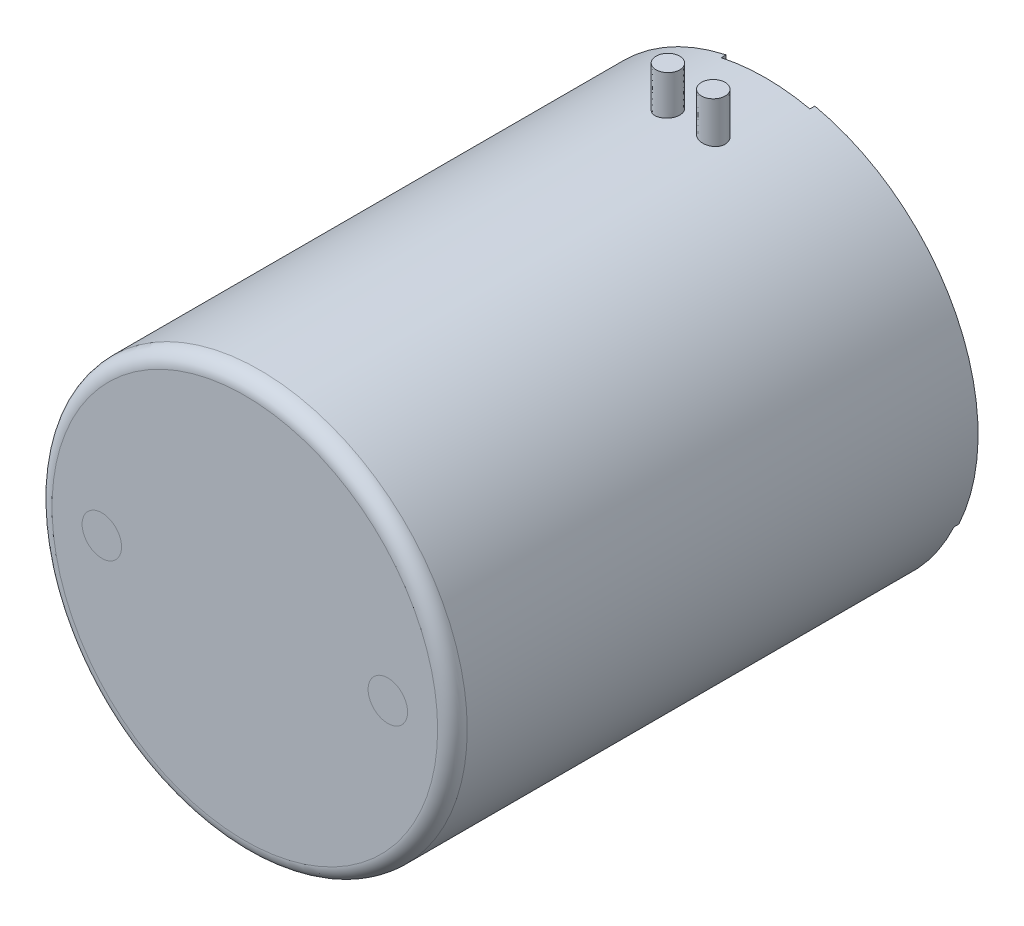
from build123d import *

# Parameters (mm, degrees)
SKETCH_1_R          = 21.05
EXTRUDE_1_DEPTH     = 53.3
FILLET_1_R          = 1.5
CUT_EXTRUDE_1_DEPTH = 0.5
SKETCH_3_R          = 7.5
EXTRUDE_2_DEPTH     = 4.2
SKETCH_4_R          = 6.5
CUT_EXTRUDE_2_DEPTH = 1
SKETCH_5_R          = 2.5
EXTRUDE_3_DEPTH     = 1.3
FILLET_2_R          = 0.75
FILLET_3_R          = 2.5
FILLET_4_R          = 0.5
SKETCH_7_W          = 9
SKETCH_7_H          = 4.55
CUT_EXTRUDE_3_DEPTH = 0.5
SKETCH_9_R          = 21
EXTRUDE_4_DEPTH     = 39.2
EXTRUDE_5_DEPTH     = 2
SKETCH_11_R         = 8
EXTRUDE_6_DEPTH     = 0.5
SKETCH_12_R         = 7.1
EXTRUDE_7_DEPTH     = 1
SKETCH_13_R         = 4
EXTRUDE_8_DEPTH     = 20
SKETCH_14_W         = 8
SKETCH_14_H         = 12
CUT_EXTRUDE_4_DEPTH = 1
SKETCH_15_R         = 2
CUT_EXTRUDE_5_DEPTH = 6
CHAMFER_1_SIZE      = 0.5
EXTRUDE_9_DEPTH     = 25
CHAMFER_2_SIZE      = 0.2
OTHER_START         = 53.3
OTHER_1_OUTLINE_R   = 21
OTHER_1_DEPTH       = 61.2


# Read off the part's stored shape, not the designer's step: 交差1
with BuildPart() as part:
    # ｽｹｯﾁ1 → ﾎﾞｽ - 押し出し1 (new body)
    with BuildSketch(Plane.XY):
        Circle(SKETCH_1_R)
    extrude(amount=EXTRUDE_1_DEPTH)

    # ﾌｨﾚｯﾄ1
    fillet_1_edges = [part.edges().sort_by_distance(p)[0] for p in [
        (-21.05, 0, 53.3),
    ]]
    fillet(fillet_1_edges, radius=FILLET_1_R)

    # ｽｹｯﾁ2 → ｶｯﾄ - 押し出し1 (cut)
    with BuildSketch(Plane(origin=(0, 0, 0), x_dir=(-1, 0, 0), z_dir=(0, 0, -1))):
        with BuildLine():
            Line((-1.767766953, -10.606601718), (-8.902744604, -17.741579369))
            ThreePointArc((-8.902744604, -17.741579369), (0, -19.85), (8.902744604, -17.741579369))
            Line((8.902744604, -17.741579369), (1.767766953, -10.606601718))
            ThreePointArc((1.767766953, -10.606601718), (0, -9.874368671), (-1.767766953, -10.606601718))
        make_face()
        with BuildLine():
            Line((-17.741579369, -8.902744604), (-9.939267924, -1.100433159))
            ThreePointArc((-9.939267924, -1.100433159), (-8.682968675, 4.960449072), (-4.1, 9.120855223))
            Line((-4.1, 9.120855223), (-4.1, 19.421959221))
            ThreePointArc((-4.1, 19.421959221), (-17.883955352, 8.613166721), (-17.741579369, -8.902744604))
        make_face()
        with BuildLine():
            Line((4.1, 19.421959221), (4.1, 9.120855223))
            ThreePointArc((4.1, 9.120855223), (8.682968675, 4.960449072), (9.939267924, -1.100433159))
            Line((9.939267924, -1.100433159), (17.741579369, -8.902744604))
            ThreePointArc((17.741579369, -8.902744604), (17.883955352, 8.613166721), (4.1, 19.421959221))
        make_face()
    extrude(amount=-CUT_EXTRUDE_1_DEPTH, mode=Mode.SUBTRACT)

    # ｽｹｯﾁ3 → ﾎﾞｽ - 押し出し2 (add)
    with BuildSketch(Plane(origin=(0, 0, 0), x_dir=(-1, 0, 0), z_dir=(0, 0, -1))):
        with Locations(Location((0, 0, 0), (0, 0, 180))):
            Circle(SKETCH_3_R)
    extrude(amount=EXTRUDE_2_DEPTH)

    # ｽｹｯﾁ4 → ｶｯﾄ - 押し出し2 (cut)
    with BuildSketch(Plane(origin=(0, 0, -4.2), x_dir=(-1, 0, 0), z_dir=(0, 0, -1))):
        Circle(SKETCH_4_R)
    extrude(amount=-CUT_EXTRUDE_2_DEPTH, mode=Mode.SUBTRACT)

    # ｽｹｯﾁ5 → ﾎﾞｽ - 押し出し3 (add)
    with BuildSketch(Plane(origin=(0, 0, -3.2), x_dir=(-1, 0, 0), z_dir=(0, 0, -1))):
        Circle(SKETCH_5_R)
    extrude(amount=EXTRUDE_3_DEPTH)

    # ﾌｨﾚｯﾄ2
    fillet_2_edges = [part.edges().sort_by_distance(p)[0] for p in [
        (2.5, 0, -4.5),
    ]]
    fillet(fillet_2_edges, radius=FILLET_2_R)

    # ﾌｨﾚｯﾄ3
    fillet_3_edges = [part.edges().sort_by_distance(p)[0] for p in [
        (-9.939267924, -1.100433159, 0.25),
        (-4.1, 9.120855223, 0.25),
        (4.1, 9.120855223, 0.25),
        (9.939267924, -1.100433159, 0.25),
    ]]
    fillet(fillet_3_edges, radius=FILLET_3_R)

    # ﾌｨﾚｯﾄ4
    fillet_4_edges = [part.edges().sort_by_distance(p)[0] for p in [
        (5.335255779, -14.174090543, 0),
        (-5.335255779, -14.174090543, 0),
        (-14.236593669, -5.397758904, 0),
        (-10.184921124, -1.070153656, 0),
        (-8.764891514, 4.814216109, 0),
        (-4.414822662, 9.401058845, 0),
        (14.236593669, -5.397758904, 0),
        (10.184921124, -1.070153656, 0),
        (8.764891514, 4.814216109, 0),
        (4.414822662, 9.401058845, 0),
        (0, -9.874368671, 0),
        (-4.1, 15.018756923, 0),
        (4.1, 15.018756923, 0),
    ]]
    fillet(fillet_4_edges, radius=FILLET_4_R - 0.0001)  # a hair under: the kernel refuses the full size

    # ｽｹｯﾁ7 → ｶｯﾄ - 押し出し3 (cut)
    with BuildSketch(Plane(origin=(0, 0, 0), x_dir=(-1, 0, 0), z_dir=(0, 0, -1))):
        with Locations((0, 18.775)):
            Rectangle(SKETCH_7_W, SKETCH_7_H)
        Polygon((-6.257895014, -16.510943341), (-9.75807358, -20.011121908), (-20.011121908, -9.75807358), (-16.510943341, -6.257895014), align=None)
        Polygon((6.257895014, -16.510943341), (16.510943341, -6.257895014), (20.011121908, -9.75807358), (9.75807358, -20.011121908), align=None)
    extrude(amount=-CUT_EXTRUDE_3_DEPTH, mode=Mode.SUBTRACT)

    # ｽｹｯﾁ9 → ﾎﾞｽ - 押し出し4 (add)
    with BuildSketch(Plane.XY.offset(53.3)):
        Circle(SKETCH_9_R)
    extrude(amount=EXTRUDE_4_DEPTH)

    # ｽｹｯﾁ10 → ﾎﾞｽ - 押し出し5 (add)
    with BuildSketch(Plane.XY.offset(92.5)):
        with BuildLine():
            Line((4.667626369, 11.595829599), (11.595829599, 4.667626369))
            ThreePointArc((11.595829599, 4.667626369), (8.838834765, -8.838834765), (-4.667626369, -11.595829599))
            Line((-4.667626369, -11.595829599), (-11.595829599, -4.667626369))
            ThreePointArc((-11.595829599, -4.667626369), (-8.838834765, 8.838834765), (4.667626369, 11.595829599))
        make_face()
    extrude(amount=EXTRUDE_5_DEPTH)

    # ｽｹｯﾁ11 → ﾎﾞｽ - 押し出し6 (add)
    with BuildSketch(Plane.XY.offset(94.5)):
        Circle(SKETCH_11_R)
    extrude(amount=EXTRUDE_6_DEPTH)

    # ｽｹｯﾁ12 → ﾎﾞｽ - 押し出し7 (add)
    with BuildSketch(Plane.XY.offset(95)):
        Circle(SKETCH_12_R)
    extrude(amount=EXTRUDE_7_DEPTH)

    # ｽｹｯﾁ13 → ﾎﾞｽ - 押し出し8 (add)
    with BuildSketch(Plane.XY.offset(94.5)):
        Circle(SKETCH_13_R)
    extrude(amount=EXTRUDE_8_DEPTH)

    # ｽｹｯﾁ14 → ｶｯﾄ - 押し出し4 (cut)
    with BuildSketch(Plane(origin=(0, 4, 0), x_dir=(1, 0, 0), z_dir=(0, 1, 0))):
        with Locations((0, -108.5)):
            Rectangle(SKETCH_14_W, SKETCH_14_H)
    extrude(amount=-CUT_EXTRUDE_4_DEPTH, mode=Mode.SUBTRACT)

    # ｽｹｯﾁ15 → ｶｯﾄ - 押し出し5 (cut)
    with BuildSketch(Plane.XY.offset(92.5)):
        with Locations((0, 17.5)):
            Circle(SKETCH_15_R)
        with Locations((17.5, 0)):
            Circle(SKETCH_15_R)
        with Locations((0, -17.5)):
            Circle(SKETCH_15_R)
        with Locations((-17.5, 0)):
            Circle(SKETCH_15_R)
    extrude(amount=-CUT_EXTRUDE_5_DEPTH, mode=Mode.SUBTRACT)

    # 面取り1
    chamfer_1_edges = [part.edges().sort_by_distance(p)[0] for p in [
        (-21, 0, 53.3),
        (-21, 0, 92.5),
    ]]
    chamfer(chamfer_1_edges, length=CHAMFER_1_SIZE)

    # ｽｹｯﾁ19 → ﾎﾞｽ - 押し出し9 (add)
    with BuildSketch(Plane(origin=(0, 0, 0), x_dir=(1, 0, 0), z_dir=(0, 1, 0))):
        with BuildLine():
            add(Edge.make_bspline(
                [(-2.3, -9.3), (-2.141895722, -9.3), (-1.984582336, -9.26831111), (-1.695786007, -9.148505891), (-1.561830045, -9.059042657), (-1.339916148, -8.83681524), (-1.250815241, -8.703488676), (-1.130324814, -8.411202826), (-1.099488051, -8.254725269), (-1.100524759, -7.937433107), (-1.132539642, -7.780879651), (-1.254416503, -7.490445543), (-1.344667636, -7.357097524), (-1.567516387, -7.136655943), (-1.702165246, -7.047850886), (-1.991590037, -6.92982589), (-2.149326122, -6.899295567), (-2.461692814, -6.900729728), (-2.617940839, -6.932319306), (-2.907178904, -7.053148359), (-3.038602416, -7.141124571), (-3.26167511, -7.365046532), (-3.349599592, -7.497417785), (-3.469481665, -7.788427754), (-3.500435327, -7.946423907), (-3.499555239, -8.260305399), (-3.467445926, -8.418673048), (-3.34669763, -8.707376797), (-3.256905259, -8.840768765), (-3.035347061, -9.061077904), (-2.902667973, -9.149452405), (-2.612947139, -9.269026571), (-2.458104278, -9.3), (-2.3, -9.3)],
                knots=[0, 0, 0, 0, 0.0625, 0.0625, 0.125, 0.125, 0.1875, 0.1875, 0.25, 0.25, 0.3125, 0.3125, 0.375, 0.375, 0.4375, 0.4375, 0.5, 0.5, 0.5625, 0.5625, 0.625, 0.625, 0.6875, 0.6875, 0.75, 0.75, 0.8125, 0.8125, 0.875, 0.875, 0.9375, 0.9375, 1, 1, 1, 1], degree=3))
        make_face()
        with BuildLine():
            add(Edge.make_bspline(
                [(2.3, -9.3), (2.458101824, -9.3), (2.615002003, -9.268333612), (2.902663727, -9.149297919), (3.036114818, -9.060490649), (3.257502016, -8.83999811), (3.346925979, -8.707290324), (3.468262095, -8.416258156), (3.499849023, -8.259893759), (3.500149899, -7.94238048), (3.468784785, -7.78588338), (3.348388342, -7.495343893), (3.259144479, -7.362166602), (3.038513671, -7.141379213), (2.905239906, -7.052187197), (2.617888296, -6.932449554), (2.460768356, -6.900612609), (2.148510682, -6.899405329), (1.991426227, -6.92973338), (1.700237772, -7.048797353), (1.567538038, -7.136292434), (1.342020343, -7.360062317), (1.253313742, -7.492276634), (1.131817712, -7.783408851), (1.100245068, -7.941102293), (1.09975782, -8.255174381), (1.131152757, -8.41364744), (1.250962434, -8.703405981), (1.340590257, -8.837664202), (1.562488668, -9.059527262), (1.695817167, -9.148670082), (1.986527204, -9.268965629), (2.141898176, -9.3), (2.3, -9.3)],
                knots=[0, 0, 0, 0, 0.0625, 0.0625, 0.125, 0.125, 0.1875, 0.1875, 0.25, 0.25, 0.3125, 0.3125, 0.375, 0.375, 0.4375, 0.4375, 0.5, 0.5, 0.5625, 0.5625, 0.625, 0.625, 0.6875, 0.6875, 0.75, 0.75, 0.8125, 0.8125, 0.875, 0.875, 0.9375, 0.9375, 1, 1, 1, 1], degree=3))
        make_face()
    extrude(amount=EXTRUDE_9_DEPTH)

    # 面取り2
    chamfer_2_edges = [part.edges().sort_by_distance(p)[0] for p in [
        (-1.645751311, -3.645751311, 114.5),
    ]]
    chamfer(chamfer_2_edges, length=CHAMFER_2_SIZE)

    # 交差1 outline → 交差1 (cut)
    with BuildSketch(Plane.XY.offset(OTHER_START)):
        Circle(OTHER_1_OUTLINE_R)
    extrude(amount=OTHER_1_DEPTH, mode=Mode.SUBTRACT)


solid = part.part
